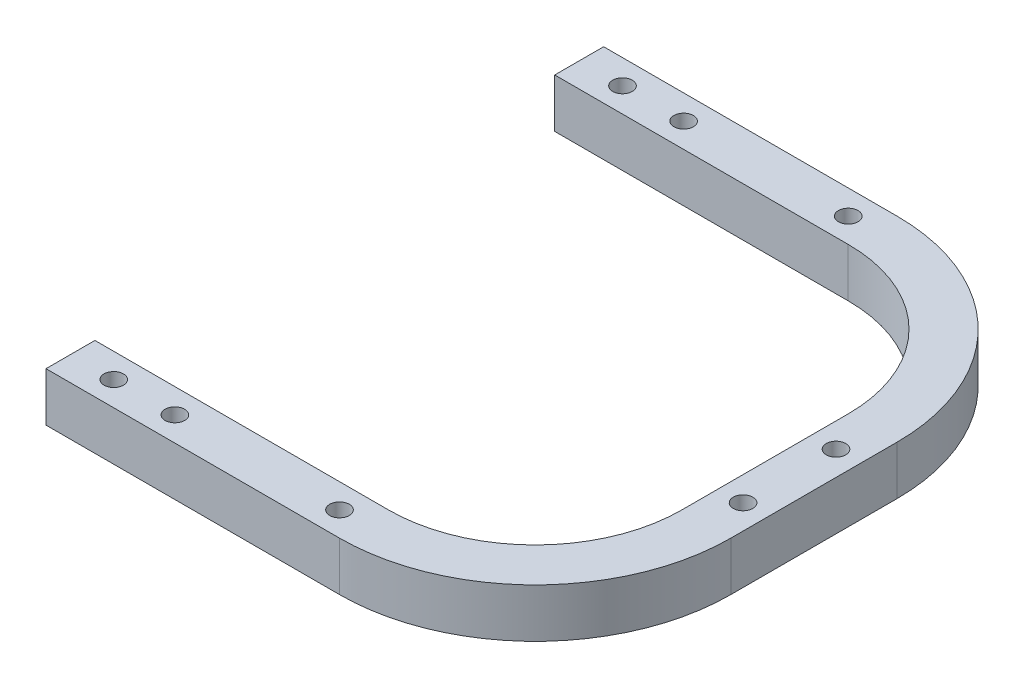
from build123d import *

# Parameters (mm, degrees)
SKETCH1_R           = 2
BOSS_EXTRUDE1_DEPTH = 10


with BuildPart() as part:
    # Sketch1 → Boss-Extrude1 (new body)
    with BuildSketch(Plane(origin=(0, 0, 0), x_dir=(1, 0, 0), z_dir=(0, 1, 0))):
        with BuildLine():
            Line((20, -47), (-40, -47))
            Line((-40, -47), (-40, -57))
            Line((-40, -57), (20, -57))
            ThreePointArc((20, -57), (48.284271247, -45.284271247), (60, -17))
            Line((60, -17), (60, 17))
            ThreePointArc((60, 17), (48.284271247, 45.284271247), (20, 57))
            Line((20, 57), (-40, 57))
            Line((-40, 57), (-40, 47))
            Line((-40, 47), (20, 47))
            ThreePointArc((20, 47), (41.213203436, 38.213203436), (50, 17))
            Line((50, 17), (50, -17))
            ThreePointArc((50, -17), (41.213203436, -38.213203436), (20, -47))
        make_face()
        with Locations((55, 9.5)):
            Circle(SKETCH1_R, mode=Mode.SUBTRACT)
        with Locations((55, -9.5)):
            Circle(SKETCH1_R, mode=Mode.SUBTRACT)
        with Locations((15, 52)):
            Circle(SKETCH1_R, mode=Mode.SUBTRACT)
        with Locations((15, -52)):
            Circle(SKETCH1_R, mode=Mode.SUBTRACT)
        with Locations((-18.651513194, 52)):
            Circle(SKETCH1_R, mode=Mode.SUBTRACT)
        with Locations((-31.151513194, 52)):
            Circle(SKETCH1_R, mode=Mode.SUBTRACT)
        with Locations((-18.651513194, -52)):
            Circle(SKETCH1_R, mode=Mode.SUBTRACT)
        with Locations((-31.151513194, -52)):
            Circle(SKETCH1_R, mode=Mode.SUBTRACT)
    extrude(amount=BOSS_EXTRUDE1_DEPTH)


solid = part.part
